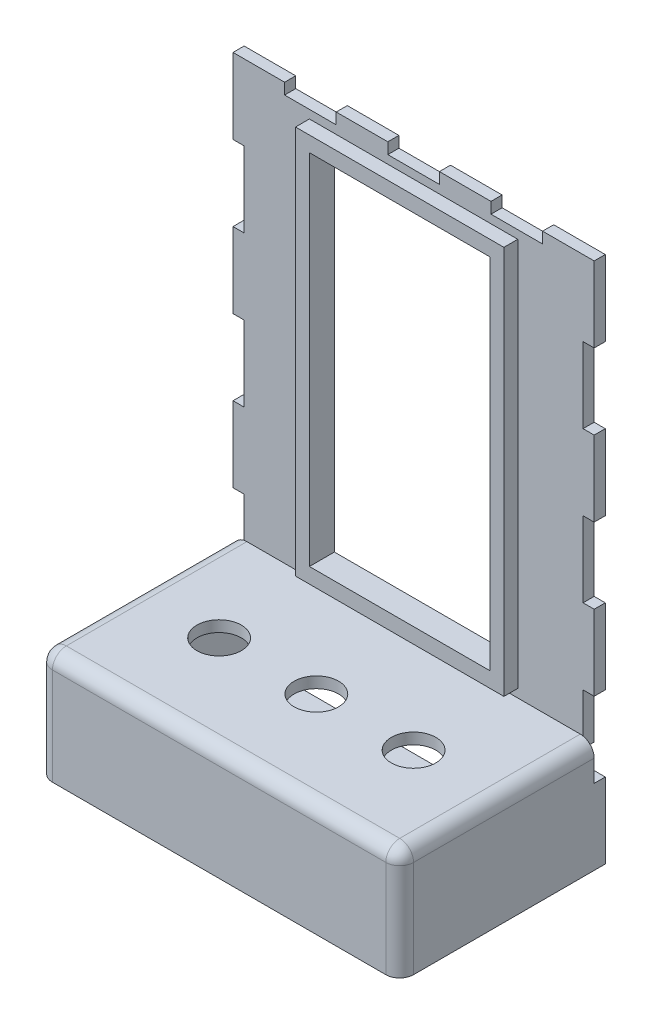
from build123d import *

# Parameters (mm, degrees)
BUITENAFMETING_RECHTHOEK_W  = 130
BUITENAFMETING_RECHTHOEK_H  = 190
PLAAT_DEPTH                 = 4
TAND_HOR_W                  = 18.571428572
TAND_HOR_H                  = 4
TAND_BOVEN_DEPTH            = 231.252035822
TANDEN_PATROON_BOVEN_COUNT  = 3
TANDEN_PATROON_BOVEN_PITCH  = 37.142857143
TAND_VER_W                  = 4
TAND_VER_H                  = 27.142857143
TAND_LINKS_DEPTH            = 231.252035822
TANDEN_PATROON_LINKS_COUNT  = 3
TANDEN_PATROON_LINKS_PITCH  = 54.285714286
TAND_O_W                    = 18.571428572
TAND_O_H                    = 4
TAND_ONDER_DEPTH            = 231.252035822
TANDEN_PATROON_ONDER_COUNT  = 3
TANDEN_PATROON_ONDER_PITCH  = 37.142857143
TAND_R_W                    = 4
TAND_R_H                    = 27.142857143
TAND_RECHTS_DEPTH           = 231.252035822
TANDEN_PATROON_RECHTS_COUNT = 3
TANDEN_PATROON_RECHTS_PITCH = 54.285714286
SKETCH1_W                   = 130
SKETCH1_H                   = 40
BOSS_EXTRUDE1_DEPTH         = 70
FILLET1_R                   = 5
CUT_EXTRUDE1_DEPTH          = 70
SKETCH4_R                   = 8
CUT_EXTRUDE2_DEPTH          = 27
SKETCH5_W                   = 75
SKETCH5_H                   = 140
BOSS_EXTRUDE2_DEPTH         = 5
SKETCH6_W                   = 65
SKETCH6_H                   = 129
CUT_EXTRUDE3_DEPTH          = 30


with BuildPart() as part:
    # Buitenafmeting Rechthoek → Plaat (new body)
    with BuildSketch(Plane.XY):
        with Locations((65, 95)):
            Rectangle(BUITENAFMETING_RECHTHOEK_W, BUITENAFMETING_RECHTHOEK_H)
    extrude(amount=-PLAAT_DEPTH)

    # Tand Hor → Tand Boven (cut, through all)
    with BuildSketch(Plane.XY):
        with Locations((27.857142857, 188)):
            Rectangle(TAND_HOR_W, TAND_HOR_H)
    tand_boven = extrude(amount=-TAND_BOVEN_DEPTH, mode=Mode.SUBTRACT)

    # Tanden Patroon Boven: Tand Boven ×3
    with Locations(*[(i * TANDEN_PATROON_BOVEN_PITCH, 0, 0) for i in range(1, TANDEN_PATROON_BOVEN_COUNT)]):
        add(tand_boven, mode=Mode.SUBTRACT)

    # Tand Ver → Tand Links (cut, through all)
    with BuildSketch(Plane.XY):
        with Locations((2, 149.285714286)):
            Rectangle(TAND_VER_W, TAND_VER_H)
    tand_links = extrude(amount=-TAND_LINKS_DEPTH, mode=Mode.SUBTRACT)

    # Tanden Patroon Links: Tand Links ×3
    with Locations(*[(0, -i * TANDEN_PATROON_LINKS_PITCH, 0) for i in range(1, TANDEN_PATROON_LINKS_COUNT)]):
        add(tand_links, mode=Mode.SUBTRACT)

    # Tand O → Tand Onder (cut, through all)
    with BuildSketch(Plane.XY):
        with Locations((27.857142857, 2)):
            Rectangle(TAND_O_W, TAND_O_H)
    tand_onder = extrude(amount=-TAND_ONDER_DEPTH, mode=Mode.SUBTRACT)

    # Tanden Patroon Onder: Tand Onder ×3
    with Locations(*[(i * TANDEN_PATROON_ONDER_PITCH, 0, 0) for i in range(1, TANDEN_PATROON_ONDER_COUNT)]):
        add(tand_onder, mode=Mode.SUBTRACT)

    # Tand R → Tand Rechts (cut, through all)
    with BuildSketch(Plane.XY):
        with Locations((128, 149.285714286)):
            Rectangle(TAND_R_W, TAND_R_H)
    tand_rechts = extrude(amount=-TAND_RECHTS_DEPTH, mode=Mode.SUBTRACT)

    # Tanden Patroon Rechts: Tand Rechts ×3
    with Locations(*[(0, -i * TANDEN_PATROON_RECHTS_PITCH, 0) for i in range(1, TANDEN_PATROON_RECHTS_COUNT)]):
        add(tand_rechts, mode=Mode.SUBTRACT)

    # Sketch1 → Boss-Extrude1 (add)
    with BuildSketch(Plane.XY):
        with Locations((65, 20)):
            Rectangle(SKETCH1_W, SKETCH1_H)
    extrude(amount=BOSS_EXTRUDE1_DEPTH)

    # Fillet1
    # the kernel refuses this fillet: 5 mm, written as the material it takes off along each edge
    with BuildSketch(Plane(origin=(5, 35, 65), x_dir=(0, 1, 0), z_dir=(-1, 0, 0))) as fillet1_piece_1_section:
        Polygon((0, 0), (FILLET1_R * 1.02, 0), (FILLET1_R * 1.02, -FILLET1_R * 1.02), (0, -FILLET1_R * 1.02), align=None)
    fillet1_piece_1 = extrude(amount=FILLET1_R * 1.02, mode=Mode.PRIVATE)
    fillet1_piece_1 = fillet1_piece_1 - Plane(origin=(5, 35, 65), x_dir=(0, -0.7071067811865475, -0.7071067811865475), z_dir=(-1, 0, 0)) * Sphere(FILLET1_R, mode=Mode.PRIVATE)
    add(fillet1_piece_1, mode=Mode.SUBTRACT)
    with BuildSketch(Plane(origin=(125, 35, 65), x_dir=(0, 0, 1), z_dir=(0, 1, 0))) as fillet1_piece_2_section:
        Polygon((0, 0), (FILLET1_R * 1.02, 0), (FILLET1_R * 1.02, FILLET1_R * 1.02), (0, FILLET1_R * 1.02), align=None)
    fillet1_piece_2 = extrude(amount=FILLET1_R * 1.02, mode=Mode.PRIVATE)
    fillet1_piece_2 = fillet1_piece_2 - Plane(origin=(125, 35, 65), x_dir=(-0.7071067811865475, 0, -0.7071067811865475), z_dir=(0, 1, 0)) * Sphere(FILLET1_R, mode=Mode.PRIVATE)
    add(fillet1_piece_2, mode=Mode.SUBTRACT)
    with BuildSketch(Plane(origin=(0, 40, 0), x_dir=(0, -1, 0), z_dir=(0, 0, 1)), Plane(origin=(130, 40, 0), x_dir=(-1, 0, 0), z_dir=(0, 0, 1))) as fillet1_piece_3:
        with BuildLine():
            CenterArc((FILLET1_R, FILLET1_R), FILLET1_R, 180, 90)
            Line((0, FILLET1_R), (0, 0))
            Line((0, 0), (FILLET1_R, 0))
        make_face()
    extrude(amount=65, mode=Mode.SUBTRACT)
    with BuildSketch(Plane(origin=(0, 35, 70), x_dir=(0, 0, -1), z_dir=(0, -1, 0))) as fillet1_piece_4:
        with BuildLine():
            CenterArc((FILLET1_R, FILLET1_R), FILLET1_R, 180, 90)
            Line((0, FILLET1_R), (0, 0))
            Line((0, 0), (FILLET1_R, 0))
        make_face()
    extrude(amount=47.5, mode=Mode.SUBTRACT)
    with BuildSketch(Plane(origin=(130, -12.5, 70), x_dir=(-1, 0, 0), z_dir=(0, 1, 0))) as fillet1_piece_5:
        with BuildLine():
            CenterArc((FILLET1_R, -FILLET1_R), FILLET1_R, 90, 90)
            Line((0, -FILLET1_R), (0, 0))
            Line((0, 0), (FILLET1_R, 0))
        make_face()
    extrude(amount=47.5, mode=Mode.SUBTRACT)
    with BuildSketch(Plane(origin=(125, 40, 70), x_dir=(0, 0, -1), z_dir=(-1, 0, 0))) as fillet1_piece_6:
        with BuildLine():
            CenterArc((FILLET1_R, FILLET1_R), FILLET1_R, 180, 90)
            Line((0, FILLET1_R), (0, 0))
            Line((0, 0), (FILLET1_R, 0))
        make_face()
    extrude(amount=120, mode=Mode.SUBTRACT)

    # Sketch2 → Cut-Extrude1 (cut)
    with BuildSketch(Plane(origin=(0, 0, -4), x_dir=(-1, 0, 0), z_dir=(0, 0, -1))):
        Polygon((-92.857142857, 4), (-4, 4), (-4, 36), (-92.857142857, 36), (-126, 36), (-126, 4), align=None)
    extrude(amount=-CUT_EXTRUDE1_DEPTH, mode=Mode.SUBTRACT)

    # Sketch4 → Cut-Extrude2 (cut)
    with BuildSketch(Plane(origin=(0, 40, 0), x_dir=(1, 0, 0), z_dir=(0, 1, 0))):
        with Locations(Location((65, -35, 0), (0, 0, 270))):
            Circle(SKETCH4_R)
        with Locations(Location((100, -35, 0), (0, 0, 270))):
            Circle(SKETCH4_R)
        with Locations(Location((30, -35, 0), (0, 0, 270))):
            Circle(SKETCH4_R)
    extrude(amount=-CUT_EXTRUDE2_DEPTH, mode=Mode.SUBTRACT)

    # Sketch5 → Boss-Extrude2 (add)
    with BuildSketch(Plane.XY):
        with Locations((65, 113)):
            Rectangle(SKETCH5_W, SKETCH5_H)
    extrude(amount=BOSS_EXTRUDE2_DEPTH)

    # Sketch6 → Cut-Extrude3 (cut)
    with BuildSketch(Plane.XY.offset(5)):
        with Locations((65, 113)):
            Rectangle(SKETCH6_W, SKETCH6_H)
    extrude(amount=-CUT_EXTRUDE3_DEPTH, mode=Mode.SUBTRACT)


solid = part.part
